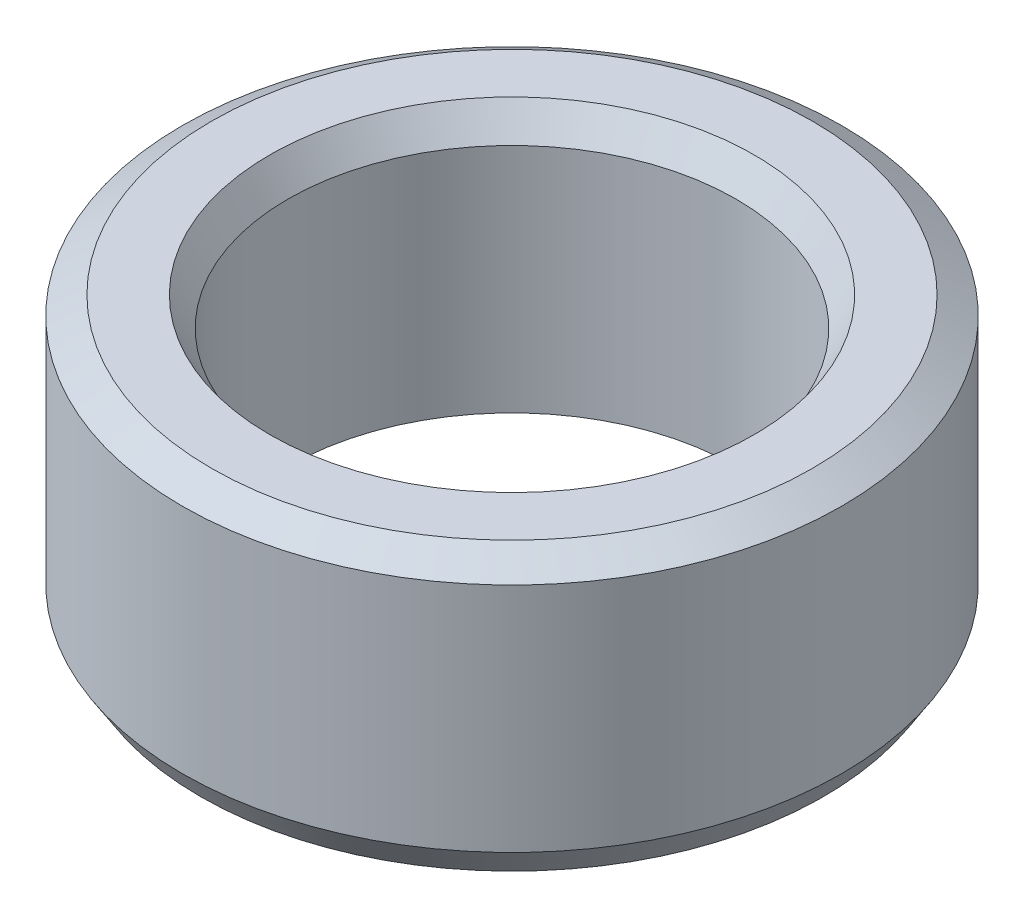
from build123d import *
from OCP.BRepFilletAPI import BRepFilletAPI_MakeChamfer

# Parameters (mm, degrees)
SKETCH1_R           = 55
BOSS_EXTRUDE1_DEPTH = 46.539392582
SKETCH2_R           = 37.371716957
CUT_EXTRUDE1_DEPTH  = 91.641685012
CHAMFER1_SIZE       = 3.047017057
CHAMFER1_SIZE2      = 4.854259174


with BuildPart() as part:
    # Sketch1 → Boss-Extrude1 (new body)
    with BuildSketch(Plane(origin=(0, 0, 0), x_dir=(1, 0, 0), z_dir=(0, 1, 0))):
        Circle(SKETCH1_R)
    extrude(amount=BOSS_EXTRUDE1_DEPTH)

    # Sketch2 → Cut-Extrude1 (cut, through all)
    with BuildSketch(Plane(origin=(0, 0, 0), x_dir=(1, 0, 0), z_dir=(0, 1, 0))):
        Circle(SKETCH2_R)
    extrude(amount=CUT_EXTRUDE1_DEPTH, mode=Mode.SUBTRACT)

    # Chamfer1: one chamfer whose edges measure the first distance from different faces: ONE call of the kernel's chamfer builder (chamfer() names one face for all edges)
    chamfer1_edges_1 = [part.edges().sort_by_distance(p)[0] for p in [
        (-37.371716957, 46.539392582, 0),
    ]]
    chamfer1_side_1 = [part.faces().sort_by_distance(p)[0] for p in [
        (-53.444365081, 46.539392582, 0),
    ]]
    chamfer1_edges_2 = [part.edges().sort_by_distance(p)[0] for p in [
        (-37.371716957, 0, 0),
    ]]
    chamfer1_side_2 = [part.faces().sort_by_distance(p)[0] for p in [
        (-37.371716957, 23.269696291, 0),
    ]]
    chamfer1_edges_3 = [part.edges().sort_by_distance(p)[0] for p in [
        (-55, 0, 0),
    ]]
    chamfer1_side_3 = [part.faces().sort_by_distance(p)[0] for p in [
        (-53.444365081, 0, 0),
    ]]
    chamfer1_edges_4 = [part.edges().sort_by_distance(p)[0] for p in [
        (-55, 46.539392582, 0),
    ]]
    chamfer1_side_4 = [part.faces().sort_by_distance(p)[0] for p in [
        (-55, 23.269696291, 0),
    ]]
    chamfer1 = BRepFilletAPI_MakeChamfer(part.part.solid().wrapped)
    for e in chamfer1_edges_1:
        chamfer1.Add(CHAMFER1_SIZE, CHAMFER1_SIZE2, e.wrapped, chamfer1_side_1[0].wrapped)  # the first distance lies on this face
    for e in chamfer1_edges_2:
        chamfer1.Add(CHAMFER1_SIZE, CHAMFER1_SIZE2, e.wrapped, chamfer1_side_2[0].wrapped)  # the first distance lies on this face
    for e in chamfer1_edges_3:
        chamfer1.Add(CHAMFER1_SIZE, CHAMFER1_SIZE2, e.wrapped, chamfer1_side_3[0].wrapped)  # the first distance lies on this face
    for e in chamfer1_edges_4:
        chamfer1.Add(CHAMFER1_SIZE, CHAMFER1_SIZE2, e.wrapped, chamfer1_side_4[0].wrapped)  # the first distance lies on this face
    add(Compound.cast(chamfer1.Shape()), mode=Mode.REPLACE)


solid = part.part
